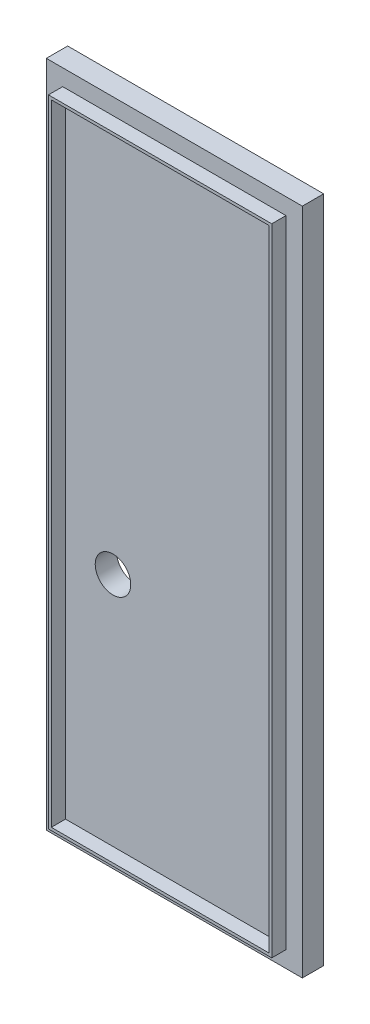
from build123d import *

# Parameters (mm, degrees)
SKETCH1_W           = 45.72
SKETCH1_H           = 119.38
BOSS_EXTRUDE1_DEPTH = 3.81
SKETCH2_W           = 39.878
SKETCH2_H           = 113.538
SKETCH2_W_2         = 38.862
SKETCH2_H_2         = 112.522
BOSS_EXTRUDE2_DEPTH = 2.54
SKETCH4_R           = 3.175
CUT_EXTRUDE1_DEPTH  = 117.215850797


with BuildPart() as part:
    # Sketch1 → Boss-Extrude1 (new body)
    with BuildSketch(Plane.XY):
        with Locations((-64.695888594, 16.466206897)):
            Rectangle(SKETCH1_W, SKETCH1_H)
    extrude(amount=BOSS_EXTRUDE1_DEPTH)

    # Sketch2 → Boss-Extrude2 (add)
    with BuildSketch(Plane.XY.offset(3.81)):
        with Locations((-64.695888594, 16.466206897)):
            Rectangle(SKETCH2_W, SKETCH2_H)
        with Locations((-64.695888594, 16.466206897)):
            Rectangle(SKETCH2_W_2, SKETCH2_H_2, mode=Mode.SUBTRACT)
    extrude(amount=BOSS_EXTRUDE2_DEPTH)

    # Sketch4 → Cut-Extrude1 (cut, through all)
    with BuildSketch(Plane(origin=(0, 0, 0), x_dir=(-1, 0, 0), z_dir=(0, 0, -1))):
        with Locations((75.650908594, 2.275226897)):
            Circle(SKETCH4_R)
    extrude(amount=-CUT_EXTRUDE1_DEPTH, mode=Mode.SUBTRACT)


solid = part.part
